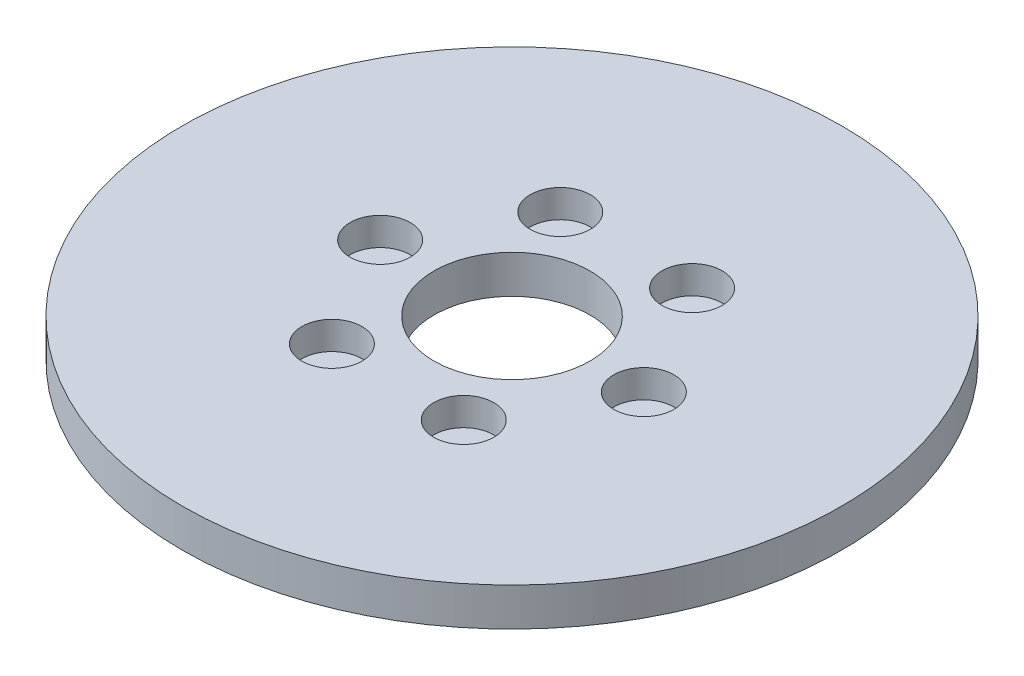
from build123d import *

# Parameters (mm, degrees)
SKETCH1_R           = 95
BOSS_EXTRUDE1_DEPTH = 11
SKETCH2_R           = 22.5
CUT_EXTRUDE1_DEPTH  = 135.799851632
SKETCH3_R           = 8.666088256
CUT_EXTRUDE2_DEPTH  = 8.054691676
CIRPATTERN1_COUNT   = 6


with BuildPart() as part:
    # Sketch1 → Boss-Extrude1 (new body)
    with BuildSketch(Plane(origin=(0, 0, 0), x_dir=(1, 0, 0), z_dir=(0, 1, 0))):
        Circle(SKETCH1_R)
    extrude(amount=BOSS_EXTRUDE1_DEPTH)

    # Sketch2 → Cut-Extrude1 (cut, through all)
    with BuildSketch(Plane(origin=(0, 0, 0), x_dir=(1, 0, 0), z_dir=(0, 1, 0))):
        Circle(SKETCH2_R)
    extrude(amount=CUT_EXTRUDE1_DEPTH, mode=Mode.SUBTRACT)

    # Sketch3 → Cut-Extrude2 (cut)
    with BuildSketch(Plane(origin=(0, 11, 0), x_dir=(1, 0, 0), z_dir=(0, 1, 0))):
        with Locations((-38.00433364, 0)):
            Circle(SKETCH3_R)
    cut_extrude2 = extrude(amount=-CUT_EXTRUDE2_DEPTH, mode=Mode.SUBTRACT)

    # CirPattern1: Cut-Extrude2 ×6 about axis
    cirpattern1_axis = Axis((0, 0, 0), (0, 1, 0))
    for i in range(1, CIRPATTERN1_COUNT):
        add(cut_extrude2.rotate(cirpattern1_axis, i * 360 / CIRPATTERN1_COUNT), mode=Mode.SUBTRACT)


solid = part.part
